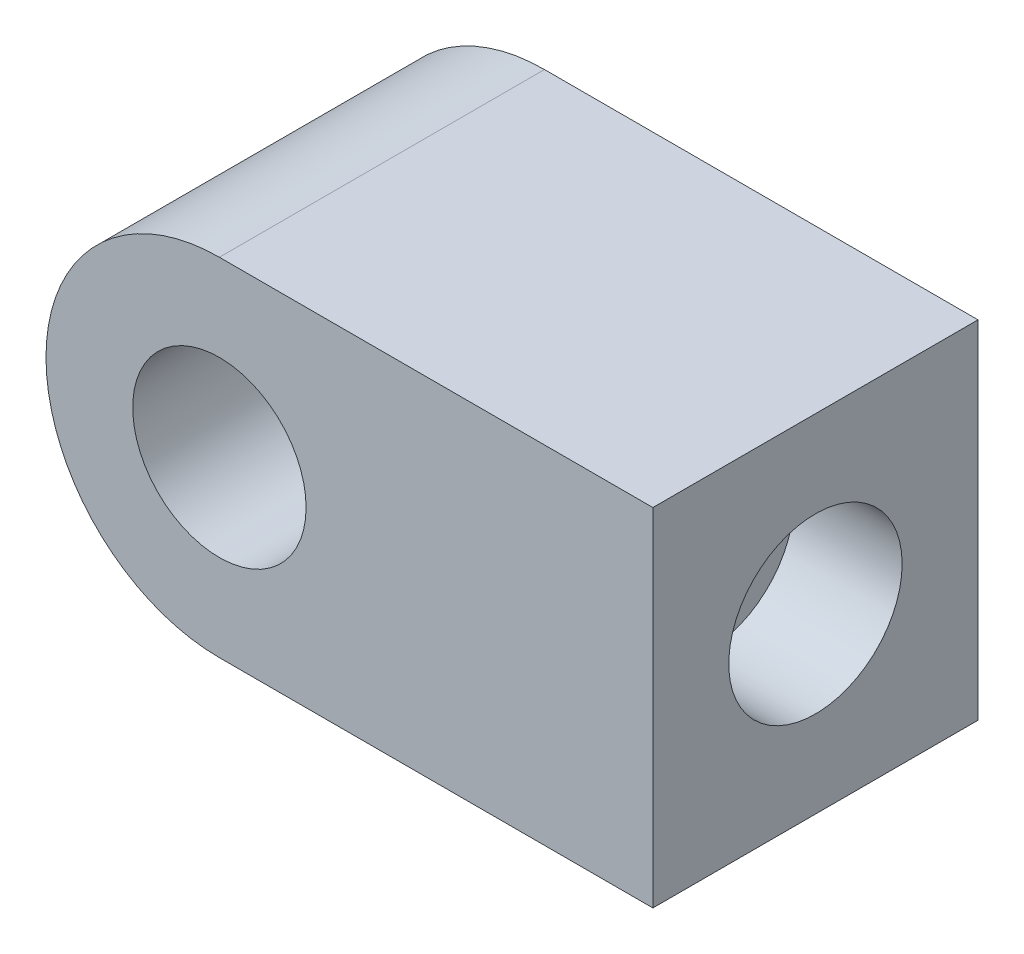
from build123d import *

# Parameters (mm, degrees)
IZIM1_R                     = 4
Y_KSEKLIK_EKSTR_ZYON1_DEPTH = 15
IZIM2_R                     = 4
KES_EKSTR_ZYON1_DEPTH       = 5


with BuildPart() as part:
    # Çizim1 → Yükseklik-Ekstrüzyon1 (new body)
    with BuildSketch(Plane.XY):
        with BuildLine():
            Line((0, 8), (20, 8))
            Line((20, 8), (20, -8))
            Line((20, -8), (0, -8))
            ThreePointArc((0, -8), (-8, 0), (0, 8))
        make_face()
        Circle(IZIM1_R, mode=Mode.SUBTRACT)
    extrude(amount=Y_KSEKLIK_EKSTR_ZYON1_DEPTH)

    # Çizim2 → Kes-Ekstrüzyon1 (cut)
    with BuildSketch(Plane(origin=(20, 0, 0), x_dir=(0, 0, -1), z_dir=(1, 0, 0))):
        with Locations((-7.5, 0)):
            Circle(IZIM2_R)
    extrude(amount=-KES_EKSTR_ZYON1_DEPTH, mode=Mode.SUBTRACT)


solid = part.part
